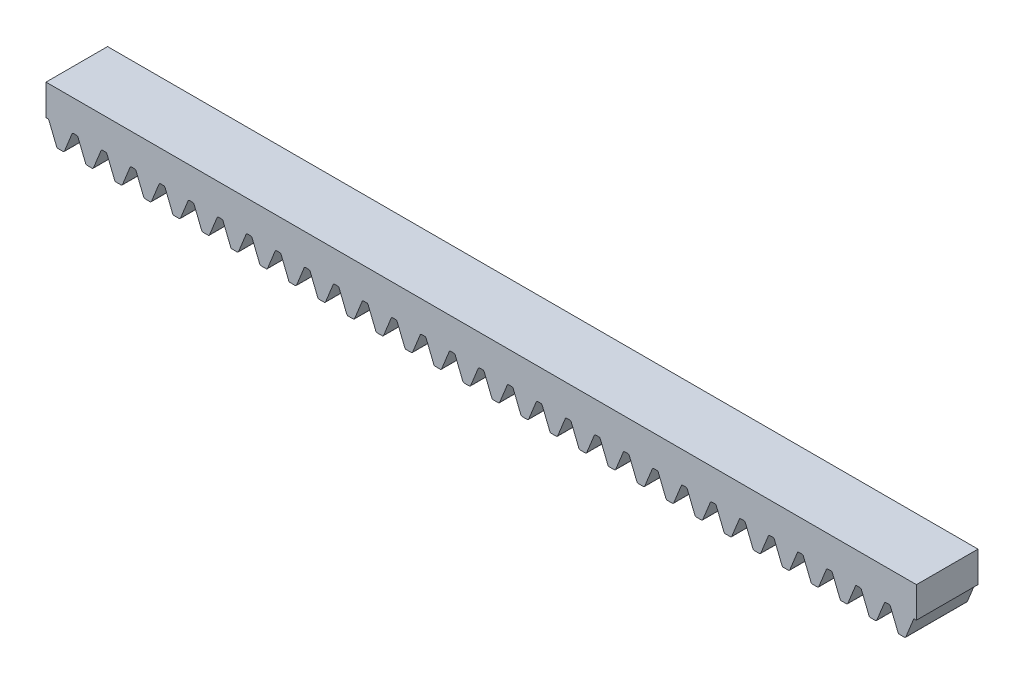
from build123d import *

# Parameters (mm, degrees)
SKETCH1_R                = 51
BOSS_EXTRUDE1_DEPTH      = 20
CUT_EXTRUDE3_DEPTH       = 75.846509605
FILLET1_R                = 0.5
CIRPATTERN1_COUNT        = 32
FILLET1_OF_CIRPATTERN1_R = 0.5
BOSS_EXTRUDE2_DEPTH      = 20
FILLET2_R                = 0.5
LPATTERN7_DEPTH          = 20


with BuildPart() as part:
    # Sketch1 → Boss-Extrude1 (new body)
    with BuildSketch(Plane.XY):
        Circle(SKETCH1_R)
    extrude(amount=BOSS_EXTRUDE1_DEPTH)

    # Sketch3 → Cut-Extrude3 (cut, through all)
    with BuildSketch(Plane.XY):
        with BuildLine():
            add(Edge.make_bspline(
                [(1.29203821, 44.486066215), (1.302814451, 44.668832694), (1.366057296, 45.076437929), (1.534105828, 45.789290586), (1.827270897, 46.705234433), (2.128888857, 47.445621669), (2.32719165, 47.88141557), (2.355248368, 47.942181898)],
                knots=[0, 0, 0, 0, 0.040008387, 0.090017613, 0.160030412, 0.250046806, 0.264674884, 0.264674884, 0.264674884, 0.264674884], degree=3))
            add(Edge.make_bspline(
                [(2.355248368, 47.942181898), (2.787245487, 48.877818018), (3.339216628, 49.848020835), (3.952343038, 50.775687882), (3.997367676, 50.843102302)],
                knots=[0.264674884, 0.264674884, 0.264674884, 0.264674884, 0.489907489, 0.507621482, 0.507621482, 0.507621482, 0.507621482], degree=3))
            ThreePointArc((3.997367676, 50.843102302), (0, 51), (-3.997367676, 50.843102302))
            add(Edge.make_bspline(
                [(-2.355248368, 47.942181898), (-2.787245487, 48.877818018), (-3.339216628, 49.848020835), (-3.952343038, 50.775687882), (-3.997367676, 50.843102302)],
                knots=[0.264674884, 0.264674884, 0.264674884, 0.264674884, 0.489907489, 0.507621482, 0.507621482, 0.507621482, 0.507621482], degree=3))
            add(Edge.make_bspline(
                [(-1.29203821, 44.486066215), (-1.302814451, 44.668832694), (-1.366057296, 45.076437929), (-1.534105828, 45.789290586), (-1.827270897, 46.705234433), (-2.128888857, 47.445621669), (-2.32719165, 47.88141557), (-2.355248368, 47.942181898)],
                knots=[0, 0, 0, 0, 0.040008387, 0.090017613, 0.160030412, 0.250046806, 0.264674884, 0.264674884, 0.264674884, 0.264674884], degree=3))
            Line((-1.29203821, 44.486066215), (-1.284640278, 44.231348604))
            ThreePointArc((-1.284640278, 44.231348604), (0, 44.25), (1.284640278, 44.231348604))
            Line((1.284640278, 44.231348604), (1.29203821, 44.486066215))
        make_face()
    cut_extrude3 = extrude(amount=CUT_EXTRUDE3_DEPTH, mode=Mode.SUBTRACT)

    # Fillet1
    fillet1_edges = [part.edges().sort_by_distance(p)[0] for p in [
        (1.284640278, 44.231348604, 10),
        (-1.284640278, 44.231348604, 10),
        (3.997367676, 50.843102302, 10),
        (-3.997367676, 50.843102302, 10),
    ]]
    fillet(fillet1_edges, radius=FILLET1_R)

    # CirPattern1: Cut-Extrude3 ×32 about axis
    cirpattern1_axis = Axis((0, 0, 71.213492813), (0, 0, -1))
    for i in range(1, CIRPATTERN1_COUNT):
        add(cut_extrude3.rotate(cirpattern1_axis, i * 360 / CIRPATTERN1_COUNT), mode=Mode.SUBTRACT)

    # Fillet1 of CirPattern1
    fillet1_of_cirpattern1_edges = [part.edges().sort_by_distance(p)[0] for p in [
        (9.889064318, 43.130834758, 10),
        (7.369151767, 43.632076529, 10),
        (13.839556578, 49.0863186, 10),
        (5.998437823, 50.646014095, 10),
        (18.113457161, 40.37282712, 10),
        (15.739751443, 41.356048222, 10),
        (23.149899081, 45.443175203, 10),
        (15.763726721, 48.502627969, 10),
        (25.641760005, 36.063314377, 10),
        (23.505481297, 37.490730174, 10),
        (31.570603945, 40.053676068, 10),
        (24.923224441, 44.49531305, 10),
        (32.184664391, 30.367908687, 10),
        (30.367908687, 32.184664391, 10),
        (38.778068205, 33.124936623, 10),
        (33.124936623, 38.778068205, 10),
        (37.490730174, 23.505481297, 10),
        (36.063314377, 25.641760005, 10),
        (44.49531305, 24.923224441, 10),
        (40.053676068, 31.570603945, 10),
        (41.356048222, 15.739751443, 10),
        (40.37282712, 18.113457161, 10),
        (48.502627969, 15.763726721, 10),
        (45.443175203, 23.149899081, 10),
        (43.632076529, 7.369151767, 10),
        (43.130834758, 9.889064318, 10),
        (50.646014095, 5.998437823, 10),
        (49.0863186, 13.839556578, 10),
        (44.231348604, -1.284640278, 10),
        (44.231348604, 1.284640278, 10),
        (50.843102302, -3.997367676, 10),
        (50.843102302, 3.997367676, 10),
        (43.130834758, -9.889064318, 10),
        (43.632076529, -7.369151767, 10),
        (49.0863186, -13.839556578, 10),
        (50.646014095, -5.998437823, 10),
        (40.37282712, -18.113457161, 10),
        (41.356048222, -15.739751443, 10),
        (45.443175203, -23.149899081, 10),
        (48.502627969, -15.763726721, 10),
        (36.063314377, -25.641760005, 10),
        (37.490730174, -23.505481297, 10),
        (40.053676068, -31.570603945, 10),
        (44.49531305, -24.923224441, 10),
        (30.367908687, -32.184664391, 10),
        (32.184664391, -30.367908687, 10),
        (33.124936623, -38.778068205, 10),
        (38.778068205, -33.124936623, 10),
        (23.505481297, -37.490730174, 10),
        (25.641760005, -36.063314377, 10),
        (24.923224441, -44.49531305, 10),
        (31.570603945, -40.053676068, 10),
        (15.739751443, -41.356048222, 10),
        (18.113457161, -40.37282712, 10),
        (15.763726721, -48.502627969, 10),
        (23.149899081, -45.443175203, 10),
        (7.369151767, -43.632076529, 10),
        (9.889064318, -43.130834758, 10),
        (5.998437823, -50.646014095, 10),
        (13.839556578, -49.0863186, 10),
        (-1.284640278, -44.231348604, 10),
        (1.284640278, -44.231348604, 10),
        (-3.997367676, -50.843102302, 10),
        (3.997367676, -50.843102302, 10),
        (-9.889064318, -43.130834758, 10),
        (-7.369151767, -43.632076529, 10),
        (-13.839556578, -49.0863186, 10),
        (-5.998437823, -50.646014095, 10),
        (-18.113457161, -40.37282712, 10),
        (-15.739751443, -41.356048222, 10),
        (-23.149899081, -45.443175203, 10),
        (-15.763726721, -48.502627969, 10),
        (-25.641760005, -36.063314377, 10),
        (-23.505481297, -37.490730174, 10),
        (-31.570603945, -40.053676068, 10),
        (-24.923224441, -44.49531305, 10),
        (-32.184664391, -30.367908687, 10),
        (-30.367908687, -32.184664391, 10),
        (-38.778068205, -33.124936623, 10),
        (-33.124936623, -38.778068205, 10),
        (-37.490730174, -23.505481297, 10),
        (-36.063314377, -25.641760005, 10),
        (-44.49531305, -24.923224441, 10),
        (-40.053676068, -31.570603945, 10),
        (-41.356048222, -15.739751443, 10),
        (-40.37282712, -18.113457161, 10),
        (-48.502627969, -15.763726721, 10),
        (-45.443175203, -23.149899081, 10),
        (-43.632076529, -7.369151767, 10),
        (-43.130834758, -9.889064318, 10),
        (-50.646014095, -5.998437823, 10),
        (-49.0863186, -13.839556578, 10),
        (-44.231348604, 1.284640278, 10),
        (-44.231348604, -1.284640278, 10),
        (-50.843102302, 3.997367676, 10),
        (-50.843102302, -3.997367676, 10),
        (-43.130834758, 9.889064318, 10),
        (-43.632076529, 7.369151767, 10),
        (-49.0863186, 13.839556578, 10),
        (-50.646014095, 5.998437823, 10),
        (-40.37282712, 18.113457161, 10),
        (-41.356048222, 15.739751443, 10),
        (-45.443175203, 23.149899081, 10),
        (-48.502627969, 15.763726721, 10),
        (-36.063314377, 25.641760005, 10),
        (-37.490730174, 23.505481297, 10),
        (-40.053676068, 31.570603945, 10),
        (-44.49531305, 24.923224441, 10),
        (-30.367908687, 32.184664391, 10),
        (-32.184664391, 30.367908687, 10),
        (-33.124936623, 38.778068205, 10),
        (-38.778068205, 33.124936623, 10),
        (-23.505481297, 37.490730174, 10),
        (-25.641760005, 36.063314377, 10),
        (-24.923224441, 44.49531305, 10),
        (-31.570603945, 40.053676068, 10),
        (-15.739751443, 41.356048222, 10),
        (-18.113457161, 40.37282712, 10),
        (-15.763726721, 48.502627969, 10),
        (-23.149899081, 45.443175203, 10),
        (-7.369151767, 43.632076529, 10),
        (-9.889064318, 43.130834758, 10),
        (-5.998437823, 50.646014095, 10),
        (-13.839556578, 49.0863186, 10),
    ]]
    fillet(fillet1_of_cirpattern1_edges, radius=FILLET1_OF_CIRPATTERN1_R)


with BuildPart() as body_2:
    # Sketch4 → Boss-Extrude2 (new body)
    with BuildSketch(Plane.XY):
        Polygon((3.871445061, 51.75), (1.144268037, 45), (-1.144268037, 45), (-3.871445061, 51.75), (-4.71238898, 51.75), (-4.71238898, 61.75), (4.71238898, 61.75), (4.71238898, 51.75), align=None)
    extrude(amount=BOSS_EXTRUDE2_DEPTH)

    # Fillet2
    fillet2_edges = [body_2.edges().sort_by_distance(p)[0] for p in [
        (-1.144268037, 45, 10),
        (1.144268037, 45, 10),
        (3.871445061, 51.75, 10),
        (-3.871445061, 51.75, 10),
    ]]
    fillet(fillet2_edges, radius=FILLET2_R)

    # LPattern7: read off the stored shape, not the designer's step
    # LPattern7 outline → LPattern7 (add)
    with BuildSketch(Plane.XY):
        with BuildLine():
            Line((4.71238898, 51.75), (5.216078641, 51.75))
            ThreePointArc((5.216078641, 51.75), (5.495675093, 51.664518786), (5.679670568, 51.437303297))
            Line((5.679670568, 51.437303297), (8.154172255, 45.312696703))
            ThreePointArc((8.154172255, 45.312696703), (8.338167731, 45.085481214), (8.617764182, 45))
            Line((8.617764182, 45), (10.231791739, 45))
            ThreePointArc((10.231791739, 45), (10.511388191, 45.085481214), (10.695383667, 45.312696703))
            Line((10.695383667, 45.312696703), (13.169885353, 51.437303297))
            ThreePointArc((13.169885353, 51.437303297), (13.353880829, 51.664518786), (13.633477281, 51.75))
            Line((13.633477281, 51.75), (14.640856602, 51.75))
            ThreePointArc((14.640856602, 51.75), (14.920453054, 51.664518786), (15.104448529, 51.437303297))
            Line((15.104448529, 51.437303297), (17.578950216, 45.312696703))
            ThreePointArc((17.578950216, 45.312696703), (17.762945691, 45.085481214), (18.042542143, 45))
            Line((18.042542143, 45), (19.6565697, 45))
            ThreePointArc((19.6565697, 45), (19.936166152, 45.085481214), (20.120161627, 45.312696703))
            Line((20.120161627, 45.312696703), (22.594663314, 51.437303297))
            ThreePointArc((22.594663314, 51.437303297), (22.77865879, 51.664518786), (23.058255241, 51.75))
            Line((23.058255241, 51.75), (24.065634563, 51.75))
            ThreePointArc((24.065634563, 51.75), (24.345231014, 51.664518786), (24.52922649, 51.437303297))
            Line((24.52922649, 51.437303297), (27.003728177, 45.312696703))
            ThreePointArc((27.003728177, 45.312696703), (27.187723652, 45.085481214), (27.467320104, 45))
            Line((27.467320104, 45), (29.081347661, 45))
            ThreePointArc((29.081347661, 45), (29.360944113, 45.085481214), (29.544939588, 45.312696703))
            Line((29.544939588, 45.312696703), (32.019441275, 51.437303297))
            ThreePointArc((32.019441275, 51.437303297), (32.20343675, 51.664518786), (32.483033202, 51.75))
            Line((32.483033202, 51.75), (33.490412523, 51.75))
            ThreePointArc((33.490412523, 51.75), (33.770008975, 51.664518786), (33.954004451, 51.437303297))
            Line((33.954004451, 51.437303297), (36.428506137, 45.312696703))
            ThreePointArc((36.428506137, 45.312696703), (36.612501613, 45.085481214), (36.892098065, 45))
            Line((36.892098065, 45), (38.506125622, 45))
            ThreePointArc((38.506125622, 45), (38.785722073, 45.085481214), (38.969717549, 45.312696703))
            Line((38.969717549, 45.312696703), (41.444219236, 51.437303297))
            ThreePointArc((41.444219236, 51.437303297), (41.628214711, 51.664518786), (41.907811163, 51.75))
            Line((41.907811163, 51.75), (42.915190484, 51.75))
            ThreePointArc((42.915190484, 51.75), (43.194786936, 51.664518786), (43.378782411, 51.437303297))
            Line((43.378782411, 51.437303297), (45.853284098, 45.312696703))
            ThreePointArc((45.853284098, 45.312696703), (46.037279574, 45.085481214), (46.316876025, 45))
            Line((46.316876025, 45), (47.930903582, 45))
            ThreePointArc((47.930903582, 45), (48.210500034, 45.085481214), (48.39449551, 45.312696703))
            Line((48.39449551, 45.312696703), (50.868997196, 51.437303297))
            ThreePointArc((50.868997196, 51.437303297), (51.052992672, 51.664518786), (51.332589124, 51.75))
            Line((51.332589124, 51.75), (52.339968445, 51.75))
            ThreePointArc((52.339968445, 51.75), (52.619564897, 51.664518786), (52.803560372, 51.437303297))
            Line((52.803560372, 51.437303297), (55.278062059, 45.312696703))
            ThreePointArc((55.278062059, 45.312696703), (55.462057534, 45.085481214), (55.741653986, 45))
            Line((55.741653986, 45), (57.355681543, 45))
            ThreePointArc((57.355681543, 45), (57.635277995, 45.085481214), (57.81927347, 45.312696703))
            Line((57.81927347, 45.312696703), (60.293775157, 51.437303297))
            ThreePointArc((60.293775157, 51.437303297), (60.477770633, 51.664518786), (60.757367084, 51.75))
            Line((60.757367084, 51.75), (61.764746406, 51.75))
            ThreePointArc((61.764746406, 51.75), (62.044342857, 51.664518786), (62.228338333, 51.437303297))
            Line((62.228338333, 51.437303297), (64.70284002, 45.312696703))
            ThreePointArc((64.70284002, 45.312696703), (64.886835495, 45.085481214), (65.166431947, 45))
            Line((65.166431947, 45), (66.780459504, 45))
            ThreePointArc((66.780459504, 45), (67.060055956, 45.085481214), (67.244051431, 45.312696703))
            Line((67.244051431, 45.312696703), (69.718553118, 51.437303297))
            ThreePointArc((69.718553118, 51.437303297), (69.902548593, 51.664518786), (70.182145045, 51.75))
            Line((70.182145045, 51.75), (71.189524366, 51.75))
            ThreePointArc((71.189524366, 51.75), (71.469120818, 51.664518786), (71.653116294, 51.437303297))
            Line((71.653116294, 51.437303297), (74.12761798, 45.312696703))
            ThreePointArc((74.12761798, 45.312696703), (74.311613456, 45.085481214), (74.591209908, 45))
            Line((74.591209908, 45), (76.205237465, 45))
            ThreePointArc((76.205237465, 45), (76.484833916, 45.085481214), (76.668829392, 45.312696703))
            Line((76.668829392, 45.312696703), (79.143331079, 51.437303297))
            ThreePointArc((79.143331079, 51.437303297), (79.327326554, 51.664518786), (79.606923006, 51.75))
            Line((79.606923006, 51.75), (80.614302327, 51.75))
            ThreePointArc((80.614302327, 51.75), (80.893898779, 51.664518786), (81.077894254, 51.437303297))
            Line((81.077894254, 51.437303297), (83.552395941, 45.312696703))
            ThreePointArc((83.552395941, 45.312696703), (83.736391417, 45.085481214), (84.015987868, 45))
            Line((84.015987868, 45), (85.630015425, 45))
            ThreePointArc((85.630015425, 45), (85.909611877, 45.085481214), (86.093607353, 45.312696703))
            Line((86.093607353, 45.312696703), (88.568109039, 51.437303297))
            ThreePointArc((88.568109039, 51.437303297), (88.752104515, 51.664518786), (89.031700967, 51.75))
            Line((89.031700967, 51.75), (90.039080288, 51.75))
            ThreePointArc((90.039080288, 51.75), (90.31867674, 51.664518786), (90.502672215, 51.437303297))
            Line((90.502672215, 51.437303297), (92.977173902, 45.312696703))
            ThreePointArc((92.977173902, 45.312696703), (93.161169377, 45.085481214), (93.440765829, 45))
            Line((93.440765829, 45), (95.054793386, 45))
            ThreePointArc((95.054793386, 45), (95.334389838, 45.085481214), (95.518385313, 45.312696703))
            Line((95.518385313, 45.312696703), (97.992887, 51.437303297))
            ThreePointArc((97.992887, 51.437303297), (98.176882476, 51.664518786), (98.456478927, 51.75))
            Line((98.456478927, 51.75), (99.463858249, 51.75))
            ThreePointArc((99.463858249, 51.75), (99.7434547, 51.664518786), (99.927450176, 51.437303297))
            Line((99.927450176, 51.437303297), (102.401951863, 45.312696703))
            ThreePointArc((102.401951863, 45.312696703), (102.585947338, 45.085481214), (102.86554379, 45))
            Line((102.86554379, 45), (104.479571347, 45))
            ThreePointArc((104.479571347, 45), (104.759167799, 45.085481214), (104.943163274, 45.312696703))
            Line((104.943163274, 45.312696703), (107.417664961, 51.437303297))
            ThreePointArc((107.417664961, 51.437303297), (107.601660436, 51.664518786), (107.881256888, 51.75))
            Line((107.881256888, 51.75), (108.888636209, 51.75))
            ThreePointArc((108.888636209, 51.75), (109.168232661, 51.664518786), (109.352228137, 51.437303297))
            Line((109.352228137, 51.437303297), (111.826729823, 45.312696703))
            ThreePointArc((111.826729823, 45.312696703), (112.010725299, 45.085481214), (112.290321751, 45))
            Line((112.290321751, 45), (113.904349308, 45))
            ThreePointArc((113.904349308, 45), (114.183945759, 45.085481214), (114.367941235, 45.312696703))
            Line((114.367941235, 45.312696703), (116.842442922, 51.437303297))
            ThreePointArc((116.842442922, 51.437303297), (117.026438397, 51.664518786), (117.306034849, 51.75))
            Line((117.306034849, 51.75), (118.31341417, 51.75))
            ThreePointArc((118.31341417, 51.75), (118.593010622, 51.664518786), (118.777006098, 51.437303297))
            Line((118.777006098, 51.437303297), (121.251507784, 45.312696703))
            ThreePointArc((121.251507784, 45.312696703), (121.43550326, 45.085481214), (121.715099711, 45))
            Line((121.715099711, 45), (123.329127269, 45))
            ThreePointArc((123.329127269, 45), (123.60872372, 45.085481214), (123.792719196, 45.312696703))
            Line((123.792719196, 45.312696703), (126.267220882, 51.437303297))
            ThreePointArc((126.267220882, 51.437303297), (126.451216358, 51.664518786), (126.73081281, 51.75))
            Line((126.73081281, 51.75), (127.738192131, 51.75))
            ThreePointArc((127.738192131, 51.75), (128.017788583, 51.664518786), (128.201784058, 51.437303297))
            Line((128.201784058, 51.437303297), (130.676285745, 45.312696703))
            ThreePointArc((130.676285745, 45.312696703), (130.860281221, 45.085481214), (131.139877672, 45))
            Line((131.139877672, 45), (132.753905229, 45))
            ThreePointArc((132.753905229, 45), (133.033501681, 45.085481214), (133.217497157, 45.312696703))
            Line((133.217497157, 45.312696703), (135.691998843, 51.437303297))
            ThreePointArc((135.691998843, 51.437303297), (135.875994319, 51.664518786), (136.155590771, 51.75))
            Line((136.155590771, 51.75), (137.162970092, 51.75))
            ThreePointArc((137.162970092, 51.75), (137.442566544, 51.664518786), (137.626562019, 51.437303297))
            Line((137.626562019, 51.437303297), (140.101063706, 45.312696703))
            ThreePointArc((140.101063706, 45.312696703), (140.285059181, 45.085481214), (140.564655633, 45))
            Line((140.564655633, 45), (142.17868319, 45))
            ThreePointArc((142.17868319, 45), (142.458279642, 45.085481214), (142.642275117, 45.312696703))
            Line((142.642275117, 45.312696703), (145.116776804, 51.437303297))
            ThreePointArc((145.116776804, 51.437303297), (145.30077228, 51.664518786), (145.580368731, 51.75))
            Line((145.580368731, 51.75), (146.587748053, 51.75))
            ThreePointArc((146.587748053, 51.75), (146.867344504, 51.664518786), (147.05133998, 51.437303297))
            Line((147.05133998, 51.437303297), (149.525841667, 45.312696703))
            ThreePointArc((149.525841667, 45.312696703), (149.709837142, 45.085481214), (149.989433594, 45))
            Line((149.989433594, 45), (151.603461151, 45))
            ThreePointArc((151.603461151, 45), (151.883057603, 45.085481214), (152.067053078, 45.312696703))
            Line((152.067053078, 45.312696703), (154.541554765, 51.437303297))
            ThreePointArc((154.541554765, 51.437303297), (154.72555024, 51.664518786), (155.005146692, 51.75))
            Line((155.005146692, 51.75), (156.012526013, 51.75))
            ThreePointArc((156.012526013, 51.75), (156.292122465, 51.664518786), (156.476117941, 51.437303297))
            Line((156.476117941, 51.437303297), (158.950619627, 45.312696703))
            ThreePointArc((158.950619627, 45.312696703), (159.134615103, 45.085481214), (159.414211555, 45))
            Line((159.414211555, 45), (161.028239112, 45))
            ThreePointArc((161.028239112, 45), (161.307835563, 45.085481214), (161.491831039, 45.312696703))
            Line((161.491831039, 45.312696703), (163.966332726, 51.437303297))
            ThreePointArc((163.966332726, 51.437303297), (164.150328201, 51.664518786), (164.429924653, 51.75))
            Line((164.429924653, 51.75), (165.437303974, 51.75))
            ThreePointArc((165.437303974, 51.75), (165.716900426, 51.664518786), (165.900895901, 51.437303297))
            Line((165.900895901, 51.437303297), (168.375397588, 45.312696703))
            ThreePointArc((168.375397588, 45.312696703), (168.559393064, 45.085481214), (168.838989515, 45))
            Line((168.838989515, 45), (170.453017072, 45))
            ThreePointArc((170.453017072, 45), (170.732613524, 45.085481214), (170.916609, 45.312696703))
            Line((170.916609, 45.312696703), (173.391110686, 51.437303297))
            ThreePointArc((173.391110686, 51.437303297), (173.575106162, 51.664518786), (173.854702614, 51.75))
            Line((173.854702614, 51.75), (174.862081935, 51.75))
            ThreePointArc((174.862081935, 51.75), (175.141678387, 51.664518786), (175.325673862, 51.437303297))
            Line((175.325673862, 51.437303297), (177.800175549, 45.312696703))
            ThreePointArc((177.800175549, 45.312696703), (177.984171024, 45.085481214), (178.263767476, 45))
            Line((178.263767476, 45), (179.877795033, 45))
            ThreePointArc((179.877795033, 45), (180.157391485, 45.085481214), (180.34138696, 45.312696703))
            Line((180.34138696, 45.312696703), (182.815888647, 51.437303297))
            ThreePointArc((182.815888647, 51.437303297), (182.999884123, 51.664518786), (183.279480574, 51.75))
            Line((183.279480574, 51.75), (184.286859896, 51.75))
            ThreePointArc((184.286859896, 51.75), (184.566456347, 51.664518786), (184.750451823, 51.437303297))
            Line((184.750451823, 51.437303297), (187.22495351, 45.312696703))
            ThreePointArc((187.22495351, 45.312696703), (187.408948985, 45.085481214), (187.688545437, 45))
            Line((187.688545437, 45), (189.302572994, 45))
            ThreePointArc((189.302572994, 45), (189.582169446, 45.085481214), (189.766164921, 45.312696703))
            Line((189.766164921, 45.312696703), (192.240666608, 51.437303297))
            ThreePointArc((192.240666608, 51.437303297), (192.424662083, 51.664518786), (192.704258535, 51.75))
            Line((192.704258535, 51.75), (193.711637856, 51.75))
            ThreePointArc((193.711637856, 51.75), (193.991234308, 51.664518786), (194.175229784, 51.437303297))
            Line((194.175229784, 51.437303297), (196.64973147, 45.312696703))
            ThreePointArc((196.64973147, 45.312696703), (196.833726946, 45.085481214), (197.113323398, 45))
            Line((197.113323398, 45), (198.727350955, 45))
            ThreePointArc((198.727350955, 45), (199.006947406, 45.085481214), (199.190942882, 45.312696703))
            Line((199.190942882, 45.312696703), (201.665444569, 51.437303297))
            ThreePointArc((201.665444569, 51.437303297), (201.849440044, 51.664518786), (202.129036496, 51.75))
            Line((202.129036496, 51.75), (203.136415817, 51.75))
            ThreePointArc((203.136415817, 51.75), (203.416012269, 51.664518786), (203.600007744, 51.437303297))
            Line((203.600007744, 51.437303297), (206.074509431, 45.312696703))
            ThreePointArc((206.074509431, 45.312696703), (206.258504907, 45.085481214), (206.538101358, 45))
            Line((206.538101358, 45), (208.152128915, 45))
            ThreePointArc((208.152128915, 45), (208.431725367, 45.085481214), (208.615720843, 45.312696703))
            Line((208.615720843, 45.312696703), (211.090222529, 51.437303297))
            ThreePointArc((211.090222529, 51.437303297), (211.274218005, 51.664518786), (211.553814457, 51.75))
            Line((211.553814457, 51.75), (212.561193778, 51.75))
            ThreePointArc((212.561193778, 51.75), (212.84079023, 51.664518786), (213.024785705, 51.437303297))
            Line((213.024785705, 51.437303297), (215.499287392, 45.312696703))
            ThreePointArc((215.499287392, 45.312696703), (215.683282867, 45.085481214), (215.962879319, 45))
            Line((215.962879319, 45), (217.576906876, 45))
            ThreePointArc((217.576906876, 45), (217.856503328, 45.085481214), (218.040498803, 45.312696703))
            Line((218.040498803, 45.312696703), (220.51500049, 51.437303297))
            ThreePointArc((220.51500049, 51.437303297), (220.698995966, 51.664518786), (220.978592417, 51.75))
            Line((220.978592417, 51.75), (221.985971739, 51.75))
            ThreePointArc((221.985971739, 51.75), (222.26556819, 51.664518786), (222.449563666, 51.437303297))
            Line((222.449563666, 51.437303297), (224.924065353, 45.312696703))
            ThreePointArc((224.924065353, 45.312696703), (225.108060828, 45.085481214), (225.38765728, 45))
            Line((225.38765728, 45), (227.001684837, 45))
            ThreePointArc((227.001684837, 45), (227.281281289, 45.085481214), (227.465276764, 45.312696703))
            Line((227.465276764, 45.312696703), (229.939778451, 51.437303297))
            ThreePointArc((229.939778451, 51.437303297), (230.123773926, 51.664518786), (230.403370378, 51.75))
            Line((230.403370378, 51.75), (231.410749699, 51.75))
            ThreePointArc((231.410749699, 51.75), (231.690346151, 51.664518786), (231.874341627, 51.437303297))
            Line((231.874341627, 51.437303297), (234.348843313, 45.312696703))
            ThreePointArc((234.348843313, 45.312696703), (234.532838789, 45.085481214), (234.812435241, 45))
            Line((234.812435241, 45), (236.426462798, 45))
            ThreePointArc((236.426462798, 45), (236.706059249, 45.085481214), (236.890054725, 45.312696703))
            Line((236.890054725, 45.312696703), (239.364556412, 51.437303297))
            ThreePointArc((239.364556412, 51.437303297), (239.548551887, 51.664518786), (239.828148339, 51.75))
            Line((239.828148339, 51.75), (240.83552766, 51.75))
            ThreePointArc((240.83552766, 51.75), (241.115124112, 51.664518786), (241.299119588, 51.437303297))
            Line((241.299119588, 51.437303297), (243.773621274, 45.312696703))
            ThreePointArc((243.773621274, 45.312696703), (243.95761675, 45.085481214), (244.237213201, 45))
            Line((244.237213201, 45), (245.851240758, 45))
            ThreePointArc((245.851240758, 45), (246.13083721, 45.085481214), (246.314832686, 45.312696703))
            Line((246.314832686, 45.312696703), (248.789334372, 51.437303297))
            ThreePointArc((248.789334372, 51.437303297), (248.973329848, 51.664518786), (249.2529263, 51.75))
            Line((249.2529263, 51.75), (250.260305621, 51.75))
            ThreePointArc((250.260305621, 51.75), (250.539902073, 51.664518786), (250.723897548, 51.437303297))
            Line((250.723897548, 51.437303297), (253.198399235, 45.312696703))
            ThreePointArc((253.198399235, 45.312696703), (253.382394711, 45.085481214), (253.661991162, 45))
            Line((253.661991162, 45), (255.276018719, 45))
            ThreePointArc((255.276018719, 45), (255.555615171, 45.085481214), (255.739610647, 45.312696703))
            Line((255.739610647, 45.312696703), (258.214112333, 51.437303297))
            ThreePointArc((258.214112333, 51.437303297), (258.398107809, 51.664518786), (258.67770426, 51.75))
            Line((258.67770426, 51.75), (259.685083582, 51.75))
            ThreePointArc((259.685083582, 51.75), (259.964680034, 51.664518786), (260.148675509, 51.437303297))
            Line((260.148675509, 51.437303297), (262.623177196, 45.312696703))
            ThreePointArc((262.623177196, 45.312696703), (262.807172671, 45.085481214), (263.086769123, 45))
            Line((263.086769123, 45), (264.70079668, 45))
            ThreePointArc((264.70079668, 45), (264.980393132, 45.085481214), (265.164388607, 45.312696703))
            Line((265.164388607, 45.312696703), (267.638890294, 51.437303297))
            ThreePointArc((267.638890294, 51.437303297), (267.82288577, 51.664518786), (268.102482221, 51.75))
            Line((268.102482221, 51.75), (269.109861543, 51.75))
            ThreePointArc((269.109861543, 51.75), (269.389457994, 51.664518786), (269.57345347, 51.437303297))
            Line((269.57345347, 51.437303297), (272.047955157, 45.312696703))
            ThreePointArc((272.047955157, 45.312696703), (272.231950632, 45.085481214), (272.511547084, 45))
            Line((272.511547084, 45), (274.125574641, 45))
            ThreePointArc((274.125574641, 45), (274.405171093, 45.085481214), (274.589166568, 45.312696703))
            Line((274.589166568, 45.312696703), (277.063668255, 51.437303297))
            ThreePointArc((277.063668255, 51.437303297), (277.24766373, 51.664518786), (277.527260182, 51.75))
            Line((277.527260182, 51.75), (278.030949843, 51.75))
            Line((278.030949843, 51.75), (278.030949843, 61.75))
            Line((278.030949843, 61.75), (4.71238898, 61.75))
            Line((4.71238898, 61.75), (4.71238898, 51.75))
        make_face()
    extrude(amount=LPATTERN7_DEPTH)


solid = body_2.part
